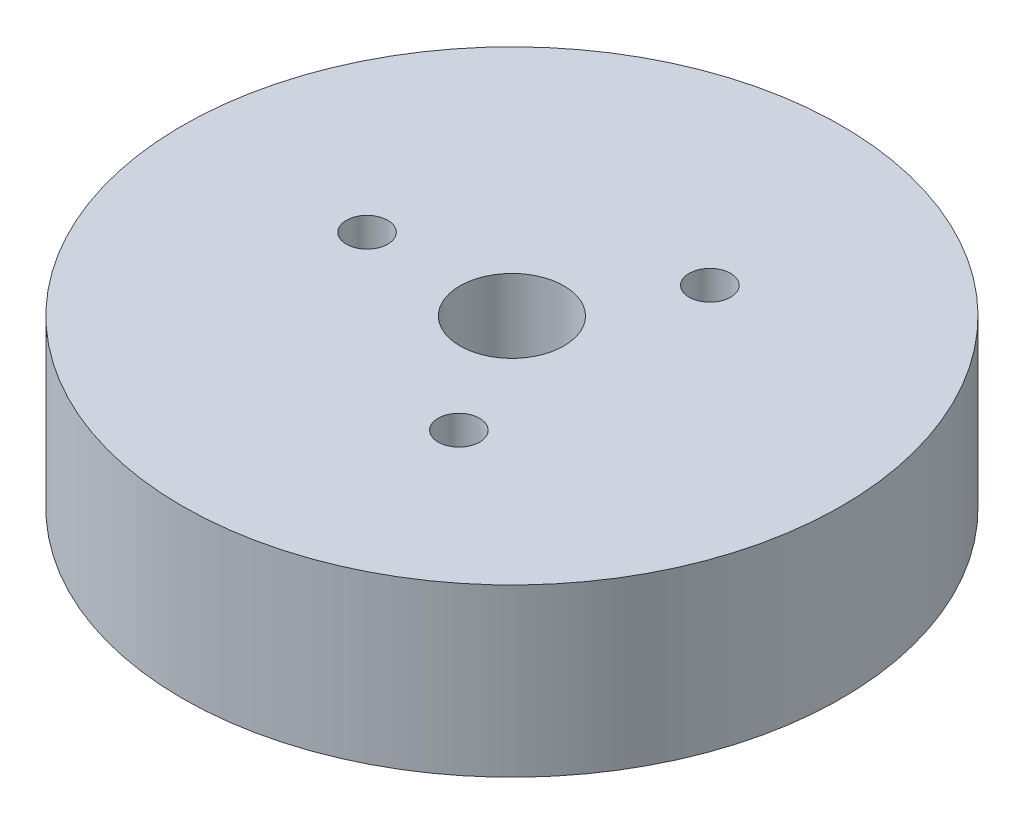
from build123d import *

# Parameters (mm, degrees)
SKETCH1_R           = 47.5
BOSS_EXTRUDE1_DEPTH = 24
SKETCH2_R           = 7.5
CUT_EXTRUDE1_DEPTH  = 72.33372274
SKETCH3_R           = 2.986457793
CUT_EXTRUDE2_DEPTH  = 19.328893374
CIRPATTERN1_COUNT   = 3


with BuildPart() as part:
    # Sketch1 → Boss-Extrude1 (new body)
    with BuildSketch(Plane(origin=(0, 0, 0), x_dir=(1, 0, 0), z_dir=(0, 1, 0))):
        Circle(SKETCH1_R)
    extrude(amount=BOSS_EXTRUDE1_DEPTH)

    # Sketch2 → Cut-Extrude1 (cut, through all)
    with BuildSketch(Plane(origin=(0, 0, 0), x_dir=(1, 0, 0), z_dir=(0, 1, 0))):
        Circle(SKETCH2_R)
    extrude(amount=CUT_EXTRUDE1_DEPTH, mode=Mode.SUBTRACT)

    # Sketch3 → Cut-Extrude2 (cut)
    with BuildSketch(Plane(origin=(0, 24, 0), x_dir=(1, 0, 0), z_dir=(0, 1, 0))):
        with Locations((-20.884210721, 0)):
            Circle(SKETCH3_R)
    cut_extrude2 = extrude(amount=-CUT_EXTRUDE2_DEPTH, mode=Mode.SUBTRACT)

    # CirPattern1: Cut-Extrude2 ×3 about axis
    cirpattern1_axis = Axis((0, 0, 0), (0, 1, 0))
    for i in range(1, CIRPATTERN1_COUNT):
        add(cut_extrude2.rotate(cirpattern1_axis, i * 360 / CIRPATTERN1_COUNT), mode=Mode.SUBTRACT)


solid = part.part
